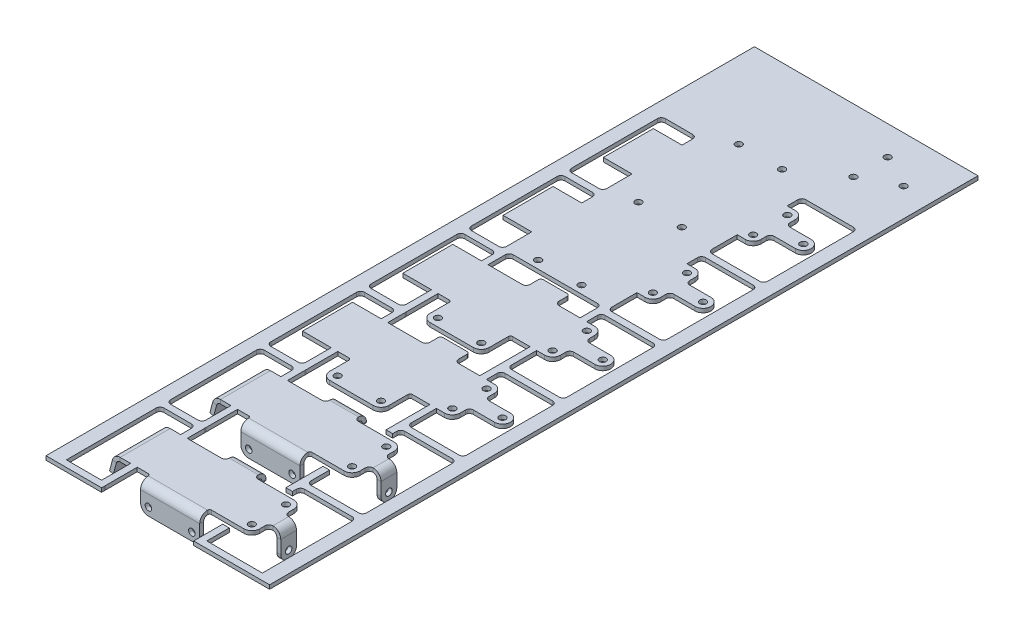
from build123d import *

# Parameters (mm, degrees)
SKETCH1_W                      = 170
SKETCH1_H                      = 3
BASE_FLANGE1_DEPTH             = 538.75
SKETCH7_R                      = 2.5
CUT_EXTRUDE1_DEPTH             = 10
LPATTERN1_COUNT                = 7
LPATTERN1_PITCH                = 76.25
CUT_EXTRUDE2_DEPTH             = 10
CUT_EXTRUDE3_DEPTH             = 10
LPATTERN2_COUNT                = 6
LPATTERN2_PITCH                = 76.25
CUT_EXTRUDE6_DEPTH             = 10
CUT_EXTRUDE7_DEPTH             = 10
LPATTERN3_COUNT                = 5
LPATTERN3_PITCH                = 76.25
SKETCHED_START                 = 52.78356
SKETCHED_BEND3_OUTLINE_W       = 3
SKETCHED_BEND3_OUTLINE_H       = 12
SKETCHED_BEND3_DEPTH           = 18.21644
SKETCHED_START_2               = 50.4
SKETCHED_BEND3_2_OUTLINE_R     = 2.5
SKETCHED_BEND3_2_DEPTH         = 1.8831962
SKETCHED_START_3               = 47.4
SKETCHED_BEND3_3_OUTLINE_R     = 2.5
SKETCHED_BEND3_3_DEPTH         = 6
SKETCHED_START_4               = 410.38
SKETCHED_BEND3_4_DEPTH         = 12
SKETCHED_START_5               = 397.38
SKETCHED_BEND4_DEPTH           = 38
SKETCHED_BEND4_2_DEPTH         = 38
SKETCHED_START_6               = -13.73
SKETCHED_BEND5_DEPTH           = 22
SKETCHED_BEND5_2_DEPTH         = 22
SKETCHED_START_7               = 387
SKETCHED_BEND5_3_DEPTH         = 7.38
SKETCHED_START_8               = 442.26356
SKETCHED_BEND6_OUTLINE_W       = 45
SKETCHED_BEND6_OUTLINE_H       = 3
SKETCHED_BEND6_DEPTH           = 15.23644
SKETCHED_START_9               = 439.88
SKETCHED_BEND6_2_OUTLINE_R     = 2.5
SKETCHED_BEND6_2_DEPTH         = 1.4260588
SKETCHED_START_10              = 436.88
SKETCHED_BEND6_3_OUTLINE_R     = 2.5
SKETCHED_BEND6_3_DEPTH         = 6
SKETCHED_START_11              = -32.73
SKETCHED_BEND6_4_DEPTH         = 45
SKETCHED_BEND7_OUTLINE_W       = 3
SKETCHED_BEND7_OUTLINE_H       = 12
SKETCHED_BEND7_DEPTH           = 18.21644
SKETCHED_BEND7_2_OUTLINE_R     = 2.5
SKETCHED_BEND7_2_DEPTH         = 1.8831962
SKETCHED_BEND7_3_OUTLINE_R     = 2.5
SKETCHED_BEND7_3_DEPTH         = 6
SKETCHED_START_12              = 486.63
SKETCHED_BEND7_4_DEPTH         = 12
SKETCHED_START_13              = 473.63
SKETCHED_BEND8_DEPTH           = 38
SKETCHED_BEND8_2_DEPTH         = 38
SKETCHED_START_14              = 462.5
SKETCHED_BEND9_OUTLINE_W       = 22
SKETCHED_BEND9_OUTLINE_H       = 3
SKETCHED_BEND9_DEPTH           = 2.71356
SKETCHED_START_15              = 467.5482038
SKETCHED_BEND9_2_DEPTH         = 0.0817962
SKETCHED_START_16              = 464.63
SKETCHED_BEND9_3_DEPTH         = 6
SKETCHED_BEND9_4_DEPTH         = 22
SKETCHED_START_17              = 518.49628
SKETCHED_BEND10_OUTLINE_W      = 45
SKETCHED_BEND10_OUTLINE_H      = 3
SKETCHED_BEND10_DEPTH          = 15.25372
SKETCHED_START_18              = 516.13
SKETCHED_BEND10_2_OUTLINE_R    = 2.5
SKETCHED_BEND10_2_DEPTH        = 2.36628
SKETCHED_START_19              = 513.13
SKETCHED_BEND10_3_OUTLINE_R    = 2.5
SKETCHED_BEND10_3_DEPTH        = 3
SKETCHED_BEND10_4_OUTLINE_R    = 2.5
SKETCHED_BEND10_4_DEPTH        = 0.63372
SKETCHED_BEND10_5_DEPTH        = 45
FILLET1_R                      = 3
FILLET2_R                      = 3
FILLET3_R                      = 3
FILLET4_R                      = 3
FILLET5_R                      = 3
FILLET6_R                      = 3
FILLET8_R                      = 3
FILLET9_R                      = 3
FILLET10_R                     = 3
FILLET11_R                     = 3
FILLET12_R                     = 3
FILLET13_R                     = 3
CUT_EXTRUDE8_REACH             = 547.858
SKETCH30_W                     = 5
SKETCH30_H                     = 5
CUT_EXTRUDE8_DIRECTION_2_DEPTH = 546.857796377
LPATTERN4_COUNT                = 2
LPATTERN4_PITCH                = 76.25


with BuildPart() as part:
    # Base-Flange1: sheet metal written as solids
    # Sketch1 → Base-Flange1 (new body)
    with BuildSketch(Plane.XY):
        with Locations((0, -1.5)):
            Rectangle(SKETCH1_W, SKETCH1_H)
    extrude(amount=BASE_FLANGE1_DEPTH)

    # Sketch7 → Cut-Extrude1 (cut)
    with BuildSketch(Plane(origin=(0, 0, 0), x_dir=(1, 0, 0), z_dir=(0, 1, 0))):
        with Locations(Location((38.4, -22.13, 0), (0, 0, 180))):
            Circle(SKETCH7_R)
        with Locations(Location((63.53, -35.13, 0), (0, 0, 180))):
            Circle(SKETCH7_R)
        with Locations(Location((38.4, -48.13, 0), (0, 0, 180))):
            Circle(SKETCH7_R)
        with Locations(Location((-26.73, -70.25, 0), (0, 0, 180))):
            Circle(SKETCH7_R)
        with Locations(Location((6.27, -70.25, 0), (0, 0, 180))):
            Circle(SKETCH7_R)
    cut_extrude1 = extrude(amount=-CUT_EXTRUDE1_DEPTH, mode=Mode.SUBTRACT)

    # LPattern1: Cut-Extrude1 ×7
    with Locations(*[(0, 0, i * LPATTERN1_PITCH) for i in range(1, LPATTERN1_COUNT)]):
        add(cut_extrude1, mode=Mode.SUBTRACT)

    # Sketch10 → Cut-Extrude2 (cut)
    with BuildSketch(Plane(origin=(0, 0, 0), x_dir=(1, 0, 0), z_dir=(0, 1, 0))):
        with BuildLine():
            Line((32.27, -92.38), (32.27, -81.25))
            Line((32.27, -81.25), (74.53, -81.25))
            Line((74.53, -81.25), (74.53, -152.5))
            Line((74.53, -152.5), (32.27, -152.5))
            Line((32.27, -152.5), (32.27, -130.38))
            Line((32.27, -130.38), (38.4, -130.38))
            ThreePointArc((38.4, -130.38), (42.642640687, -128.622640687), (44.4, -124.38))
            Line((44.4, -124.38), (44.4, -120.38))
            ThreePointArc((44.4, -120.38), (45.278679656, -118.258679656), (47.4, -117.38))
            Line((47.4, -117.38), (63.53, -117.38))
            ThreePointArc((63.53, -117.38), (69.53, -111.38), (63.53, -105.38))
            Line((63.53, -105.38), (47.4, -105.38))
            ThreePointArc((47.4, -105.38), (45.278679656, -104.501320344), (44.4, -102.38))
            Line((44.4, -102.38), (44.4, -98.38))
            ThreePointArc((44.4, -98.38), (42.642640687, -94.137359313), (38.4, -92.38))
            Line((38.4, -92.38), (32.27, -92.38))
        make_face()
    cut_extrude2 = extrude(amount=-CUT_EXTRUDE2_DEPTH, mode=Mode.SUBTRACT)

    # Sketch11 → Cut-Extrude3 (cut)
    with BuildSketch(Plane(origin=(0, 0, 0), x_dir=(1, 0, 0), z_dir=(0, 1, 0))):
        Polygon((-47.73, -130.38), (-47.73, -152.5), (-74.53, -152.5), (-74.53, -81.25), (-47.73, -81.25), (-47.73, -92.38), (-69.53, -92.38), (-69.53, -130.38), align=None)
    cut_extrude3 = extrude(amount=-CUT_EXTRUDE3_DEPTH, mode=Mode.SUBTRACT)

    # LPattern2: Cut-Extrude2, Cut-Extrude3 ×6
    with Locations(*[(0, 0, i * LPATTERN2_PITCH) for i in range(1, LPATTERN2_COUNT)]):
        add(cut_extrude2, mode=Mode.SUBTRACT)
        add(cut_extrude3, mode=Mode.SUBTRACT)

    # Sketch14 → Cut-Extrude6 (cut)
    with BuildSketch(Plane(origin=(0, 0, 0), x_dir=(1, 0, 0), z_dir=(0, 1, 0))):
        with BuildLine():
            Line((-42.73, -244.88), (-42.73, -231.75))
            ThreePointArc((-42.73, -231.75), (-41.851320344, -229.628679656), (-39.73, -228.75))
            Line((-39.73, -228.75), (24.27, -228.75))
            ThreePointArc((24.27, -228.75), (26.391320344, -229.628679656), (27.27, -231.75))
            Line((27.27, -231.75), (27.27, -244.88))
            Line((27.27, -244.88), (11.27, -244.88))
            ThreePointArc((11.27, -244.88), (9.148679656, -244.001320344), (8.27, -241.88))
            Line((8.27, -241.88), (8.27, -235.75))
            ThreePointArc((8.27, -235.75), (7.684213562, -234.335786438), (6.27, -233.75))
            Line((6.27, -233.75), (-11.73, -233.75))
            ThreePointArc((-11.73, -233.75), (-13.144213562, -234.335786438), (-13.73, -235.75))
            Line((-13.73, -235.75), (-13.73, -241.88))
            ThreePointArc((-13.73, -241.88), (-14.608679656, -244.001320344), (-16.73, -244.88))
            Line((-16.73, -244.88), (-42.73, -244.88))
        make_face()
    cut_extrude6 = extrude(amount=-CUT_EXTRUDE6_DEPTH, mode=Mode.SUBTRACT)

    # Sketch15 → Cut-Extrude7 (cut)
    with BuildSketch(Plane(origin=(0, 0, 0), x_dir=(1, 0, 0), z_dir=(0, 1, 0))):
        with BuildLine():
            Line((-42.73, -307), (-42.73, -282.88))
            Line((-42.73, -282.88), (-34.23, -282.88))
            ThreePointArc((-34.23, -282.88), (-33.169339828, -283.319339828), (-32.73, -284.38))
            Line((-32.73, -284.38), (-32.73, -299))
            ThreePointArc((-32.73, -299), (-30.972640687, -303.242640687), (-26.73, -305))
            Line((-26.73, -305), (6.27, -305))
            ThreePointArc((6.27, -305), (10.512640687, -303.242640687), (12.27, -299))
            Line((12.27, -299), (12.27, -284.38))
            ThreePointArc((12.27, -284.38), (12.709339828, -283.319339828), (13.77, -282.88))
            Line((13.77, -282.88), (27.27, -282.88))
            Line((27.27, -282.88), (27.27, -307))
            ThreePointArc((27.27, -307), (26.391320344, -309.121320344), (24.27, -310))
            Line((24.27, -310), (-39.73, -310))
            ThreePointArc((-39.73, -310), (-41.851320344, -309.121320344), (-42.73, -307))
        make_face()
    cut_extrude7 = extrude(amount=-CUT_EXTRUDE7_DEPTH, mode=Mode.SUBTRACT)

    # LPattern3: Cut-Extrude6, Cut-Extrude7 ×5
    with Locations(*[(0, 0, i * LPATTERN3_PITCH) for i in range(1, LPATTERN3_COUNT)]):
        add(cut_extrude6, mode=Mode.SUBTRACT)
        add(cut_extrude7, mode=Mode.SUBTRACT)

    # Sketched Bend3: read off the stored shape, not the designer's step
    # Sketched Bend3 outline → Sketched Bend3 (cut)
    with BuildSketch(Plane.YZ.offset(SKETCHED_START)):
        with Locations((-1.5, 416.38)):
            Rectangle(SKETCHED_BEND3_OUTLINE_W, SKETCHED_BEND3_OUTLINE_H)
    extrude(amount=SKETCHED_BEND3_DEPTH, mode=Mode.SUBTRACT)

    # Sketched Bend3 2 outline → Sketched Bend3 2 (add)
    with BuildSketch(Plane.YZ.offset(SKETCHED_START_2)):
        with BuildLine():
            Line((-3, 422.38), (-16.003894325, 422.38))
            ThreePointArc((-16.003894325, 422.38), (-22.003894325, 416.38), (-16.003894325, 410.38))
            Line((-16.003894325, 410.38), (-3, 410.38))
            Line((-3, 410.38), (-3, 422.38))
        make_face()
        with Locations((-16.003894325, 416.38)):
            Circle(SKETCHED_BEND3_2_OUTLINE_R, mode=Mode.SUBTRACT)
    extrude(amount=SKETCHED_BEND3_2_DEPTH)

    # Sketched Bend3 3 outline → Sketched Bend3 3 (add)
    with BuildSketch(Plane.YZ.offset(SKETCHED_START_3)):
        with BuildLine():
            Line((-3, 422.38), (-16.003894325, 422.38))
            ThreePointArc((-16.003894325, 422.38), (-22.003894325, 416.38), (-16.003894325, 410.38))
            Line((-16.003894325, 410.38), (-3, 410.38))
            Line((-3, 410.38), (-3, 422.38))
        make_face()
        with Locations((-16.003894325, 416.38)):
            Circle(SKETCHED_BEND3_3_OUTLINE_R, mode=Mode.SUBTRACT)
    extrude(amount=SKETCHED_BEND3_3_DEPTH)

    # Sketched Bend3 4 outline → Sketched Bend3 4 (cut)
    with BuildSketch(Plane.XY.offset(SKETCHED_START_4)):
        with BuildLine():
            Line((50.4, -24), (50.4, -6))
            ThreePointArc((50.4, -6), (49.521320344, -3.878679656), (47.4, -3))
            Line((47.4, -3), (47.4, -24))
            Line((47.4, -24), (50.4, -24))
        make_face()
        with BuildLine():
            Line((46, 2), (46, 0))
            Line((46, 0), (47.4, 0))
            ThreePointArc((47.4, 0), (51.642640687, -1.757359313), (53.4, -6))
            Line((53.4, -6), (53.4, -3))
            Line((53.4, -3), (52.78356, -3))
            Line((52.78356, -3), (52.78356, 2))
            Line((52.78356, 2), (46, 2))
        make_face()
    extrude(amount=SKETCHED_BEND3_4_DEPTH, mode=Mode.SUBTRACT)

    # Sketched Bend4: read off the stored shape, not the designer's step
    # Sketched Bend4 outline → Sketched Bend4 (cut)
    with BuildSketch(Plane.XY.offset(SKETCHED_START_5)):
        with BuildLine():
            ThreePointArc((-60.926152423, -3), (-58.73, -0.803847577), (-55.73, 0))
            Line((-55.73, 0), (-69.53, 0))
            Line((-69.53, 0), (-69.53, -3))
            Line((-69.53, -3), (-60.926152423, -3))
        make_face()
    extrude(amount=SKETCHED_BEND4_DEPTH, mode=Mode.SUBTRACT)

    # Sketched Bend4 2 outline → Sketched Bend4 2 (add)
    with BuildSketch(Plane.XY.offset(SKETCHED_START_5)):
        with BuildLine():
            Line((-55.73, -3), (-60.926152423, -3))
            ThreePointArc((-60.926152423, -3), (-61.273277195, -3.703899406), (-61.525554958, -4.447085729))
            Line((-61.525554958, -4.447085729), (-63.775963763, -12.845725728))
            Line((-63.775963763, -12.845725728), (-60.878186284, -13.622182863))
            Line((-60.878186284, -13.622182863), (-58.627777479, -5.223542865))
            ThreePointArc((-58.627777479, -5.223542865), (-57.556284287, -3.619939979), (-55.73, -3))
        make_face()
    extrude(amount=SKETCHED_BEND4_2_DEPTH)

    # Sketched Bend5: read off the stored shape, not the designer's step
    # Sketched Bend5 outline → Sketched Bend5 (cut)
    with BuildSketch(Plane.YZ.offset(SKETCHED_START_6)):
        with BuildLine():
            Line((0, 386.25), (0, 394.38))
            ThreePointArc((0, 394.38), (-0.803847577, 391.38), (-3, 389.183847577))
            Line((-3, 389.183847577), (-3, 386.25))
            Line((-3, 386.25), (0, 386.25))
        make_face()
    extrude(amount=SKETCHED_BEND5_DEPTH, mode=Mode.SUBTRACT)

    # Sketched Bend5 2 outline → Sketched Bend5 2 (add)
    with BuildSketch(Plane.YZ.offset(SKETCHED_START_6)):
        with BuildLine():
            ThreePointArc((-6, 388.38), (-4.447085729, 388.584445042), (-3, 389.183847577))
            Line((-3, 389.183847577), (-3, 394.38))
            ThreePointArc((-3, 394.38), (-3.878679656, 392.258679656), (-6, 391.38))
            Line((-6, 391.38), (-8.003894325, 391.38))
            Line((-8.003894325, 391.38), (-8.003894325, 388.38))
            Line((-8.003894325, 388.38), (-6, 388.38))
        make_face()
    extrude(amount=SKETCHED_BEND5_2_DEPTH)

    # Sketched Bend5 3 outline → Sketched Bend5 3 (cut)
    with BuildSketch(Plane.XY.offset(SKETCHED_START_7)):
        with BuildLine():
            Line((-13.73, -8.003894325), (-11.73, -8.003894325))
            ThreePointArc((-11.73, -8.003894325), (-13.144213562, -7.418107887), (-13.73, -6.003894325))
            Line((-13.73, -6.003894325), (-13.73, -8.003894325))
        make_face()
        with BuildLine():
            ThreePointArc((8.27, -6.003894325), (7.684213563, -7.418107887), (6.27, -8.003894325))
            Line((6.27, -8.003894325), (8.27, -8.003894325))
            Line((8.27, -8.003894325), (8.27, -6.003894325))
        make_face()
    extrude(amount=SKETCHED_BEND5_3_DEPTH, mode=Mode.SUBTRACT)

    # Sketched Bend6: read off the stored shape, not the designer's step
    # Sketched Bend6 outline → Sketched Bend6 (cut)
    with BuildSketch(Plane.XY.offset(SKETCHED_START_8)):
        with Locations((-10.23, -1.5)):
            Rectangle(SKETCHED_BEND6_OUTLINE_W, SKETCHED_BEND6_OUTLINE_H)
    extrude(amount=SKETCHED_BEND6_DEPTH, mode=Mode.SUBTRACT)

    # Sketched Bend6 2 outline → Sketched Bend6 2 (add)
    with BuildSketch(Plane.XY.offset(SKETCHED_START_9)):
        with BuildLine():
            Line((12.27, -14.493894325), (12.27, -3))
            Line((12.27, -3), (-32.73, -3))
            Line((-32.73, -3), (-32.73, -14.493894325))
            ThreePointArc((-32.73, -14.493894325), (-30.972640688, -18.736535012), (-26.73, -20.493894325))
            Line((-26.73, -20.493894325), (6.27, -20.493894325))
            ThreePointArc((6.27, -20.493894325), (10.512640687, -18.736535012), (12.27, -14.493894325))
        make_face()
        with Locations((-26.73, -14.493894325)):
            Circle(SKETCHED_BEND6_2_OUTLINE_R, mode=Mode.SUBTRACT)
        with Locations((6.27, -14.493894325)):
            Circle(SKETCHED_BEND6_2_OUTLINE_R, mode=Mode.SUBTRACT)
    extrude(amount=SKETCHED_BEND6_2_DEPTH)

    # Sketched Bend6 3 outline → Sketched Bend6 3 (add)
    with BuildSketch(Plane.XY.offset(SKETCHED_START_10)):
        with BuildLine():
            Line((12.27, -14.493894325), (12.27, -3))
            Line((12.27, -3), (-32.73, -3))
            Line((-32.73, -3), (-32.73, -14.493894325))
            ThreePointArc((-32.73, -14.493894325), (-30.972640688, -18.736535012), (-26.73, -20.493894325))
            Line((-26.73, -20.493894325), (6.27, -20.493894325))
            ThreePointArc((6.27, -20.493894325), (10.512640687, -18.736535012), (12.27, -14.493894325))
        make_face()
        with Locations((-26.73, -14.493894325)):
            Circle(SKETCHED_BEND6_3_OUTLINE_R, mode=Mode.SUBTRACT)
        with Locations((6.27, -14.493894325)):
            Circle(SKETCHED_BEND6_3_OUTLINE_R, mode=Mode.SUBTRACT)
    extrude(amount=SKETCHED_BEND6_3_DEPTH)

    # Sketched Bend6 4 outline → Sketched Bend6 4 (cut)
    with BuildSketch(Plane.YZ.offset(SKETCHED_START_11)):
        with BuildLine():
            Line((-6, 439.88), (-20.493894325, 439.88))
            Line((-20.493894325, 439.88), (-20.493894325, 436.88))
            Line((-20.493894325, 436.88), (-3, 436.88))
            ThreePointArc((-3, 436.88), (-3.878679656, 439.001320344), (-6, 439.88))
        make_face()
        with BuildLine():
            ThreePointArc((-6, 442.88), (-1.757359313, 441.122640687), (0, 436.88))
            Line((0, 436.88), (0, 442.26356))
            Line((0, 442.26356), (-3, 442.26356))
            Line((-3, 442.26356), (-3, 442.88))
            Line((-3, 442.88), (-6, 442.88))
        make_face()
    extrude(amount=SKETCHED_BEND6_4_DEPTH, mode=Mode.SUBTRACT)

    # Sketched Bend7: read off the stored shape, not the designer's step
    # Sketched Bend7 outline → Sketched Bend7 (cut)
    with BuildSketch(Plane.YZ.offset(SKETCHED_START)):
        with Locations((-1.5, 492.63)):
            Rectangle(SKETCHED_BEND7_OUTLINE_W, SKETCHED_BEND7_OUTLINE_H)
    extrude(amount=SKETCHED_BEND7_DEPTH, mode=Mode.SUBTRACT)

    # Sketched Bend7 2 outline → Sketched Bend7 2 (add)
    with BuildSketch(Plane.YZ.offset(SKETCHED_START_2)):
        with BuildLine():
            Line((-16.003894325, 486.63), (-3, 486.63))
            Line((-3, 486.63), (-3, 498.63))
            Line((-3, 498.63), (-16.003894325, 498.63))
            ThreePointArc((-16.003894325, 498.63), (-22.003894325, 492.63), (-16.003894325, 486.63))
        make_face()
        with Locations((-16.003894325, 492.63)):
            Circle(SKETCHED_BEND7_2_OUTLINE_R, mode=Mode.SUBTRACT)
    extrude(amount=SKETCHED_BEND7_2_DEPTH)

    # Sketched Bend7 3 outline → Sketched Bend7 3 (add)
    with BuildSketch(Plane.YZ.offset(SKETCHED_START_3)):
        with BuildLine():
            Line((-16.003894325, 486.63), (-3, 486.63))
            Line((-3, 486.63), (-3, 498.63))
            Line((-3, 498.63), (-16.003894325, 498.63))
            ThreePointArc((-16.003894325, 498.63), (-22.003894325, 492.63), (-16.003894325, 486.63))
        make_face()
        with Locations((-16.003894325, 492.63)):
            Circle(SKETCHED_BEND7_3_OUTLINE_R, mode=Mode.SUBTRACT)
    extrude(amount=SKETCHED_BEND7_3_DEPTH)

    # Sketched Bend7 4 outline → Sketched Bend7 4 (cut)
    with BuildSketch(Plane.XY.offset(SKETCHED_START_12)):
        with BuildLine():
            Line((50.4, -24), (50.4, -6))
            ThreePointArc((50.4, -6), (49.521320344, -3.878679656), (47.4, -3))
            Line((47.4, -3), (47.4, -24))
            Line((47.4, -24), (50.4, -24))
        make_face()
        with BuildLine():
            Line((46, 2), (46, 0))
            Line((46, 0), (47.4, 0))
            ThreePointArc((47.4, 0), (51.642640687, -1.757359313), (53.4, -6))
            Line((53.4, -6), (53.4, -3))
            Line((53.4, -3), (52.78356, -3))
            Line((52.78356, -3), (52.78356, 2))
            Line((52.78356, 2), (46, 2))
        make_face()
    extrude(amount=SKETCHED_BEND7_4_DEPTH, mode=Mode.SUBTRACT)

    # Sketched Bend8: read off the stored shape, not the designer's step
    # Sketched Bend8 outline → Sketched Bend8 (cut)
    with BuildSketch(Plane.XY.offset(SKETCHED_START_13)):
        with BuildLine():
            ThreePointArc((-60.926152423, -3), (-58.73, -0.803847577), (-55.73, 0))
            Line((-55.73, 0), (-69.53, 0))
            Line((-69.53, 0), (-69.53, -3))
            Line((-69.53, -3), (-60.926152423, -3))
        make_face()
    extrude(amount=SKETCHED_BEND8_DEPTH, mode=Mode.SUBTRACT)

    # Sketched Bend8 2 outline → Sketched Bend8 2 (add)
    with BuildSketch(Plane.XY.offset(SKETCHED_START_13)):
        with BuildLine():
            Line((-55.73, -3), (-60.926152423, -3))
            ThreePointArc((-60.926152423, -3), (-61.273277195, -3.703899406), (-61.525554958, -4.447085729))
            Line((-61.525554958, -4.447085729), (-63.775963763, -12.845725728))
            Line((-63.775963763, -12.845725728), (-60.878186284, -13.622182863))
            Line((-60.878186284, -13.622182863), (-58.627777479, -5.223542865))
            ThreePointArc((-58.627777479, -5.223542865), (-57.556284287, -3.619939979), (-55.73, -3))
        make_face()
    extrude(amount=SKETCHED_BEND8_2_DEPTH)

    # Sketched Bend9: read off the stored shape, not the designer's step
    # Sketched Bend9 outline → Sketched Bend9 (cut)
    with BuildSketch(Plane.XY.offset(SKETCHED_START_14)):
        with Locations((-2.73, -1.5)):
            Rectangle(SKETCHED_BEND9_OUTLINE_W, SKETCHED_BEND9_OUTLINE_H)
    extrude(amount=SKETCHED_BEND9_DEPTH, mode=Mode.SUBTRACT)

    # Sketched Bend9 2 outline → Sketched Bend9 2 (add)
    with BuildSketch(Plane.XY.offset(SKETCHED_START_15)):
        with BuildLine():
            Line((8.27, -3), (-13.73, -3))
            Line((-13.73, -3), (-13.73, -6.003894325))
            ThreePointArc((-13.73, -6.003894325), (-13.144213562, -7.418107887), (-11.73, -8.003894325))
            Line((-11.73, -8.003894325), (6.27, -8.003894325))
            ThreePointArc((6.27, -8.003894325), (7.684213563, -7.418107887), (8.27, -6.003894325))
            Line((8.27, -6.003894325), (8.27, -3))
        make_face()
    extrude(amount=SKETCHED_BEND9_2_DEPTH)

    # Sketched Bend9 3 outline → Sketched Bend9 3 (add)
    with BuildSketch(Plane.XY.offset(SKETCHED_START_16)):
        with BuildLine():
            Line((8.27, -3), (-13.73, -3))
            Line((-13.73, -3), (-13.73, -6.003894325))
            ThreePointArc((-13.73, -6.003894325), (-13.144213562, -7.418107887), (-11.73, -8.003894325))
            Line((-11.73, -8.003894325), (6.27, -8.003894325))
            ThreePointArc((6.27, -8.003894325), (7.684213563, -7.418107887), (8.27, -6.003894325))
            Line((8.27, -6.003894325), (8.27, -3))
        make_face()
    extrude(amount=SKETCHED_BEND9_3_DEPTH)

    # Sketched Bend9 4 outline → Sketched Bend9 4 (cut)
    with BuildSketch(Plane.YZ.offset(SKETCHED_START_6)):
        with BuildLine():
            Line((0, 465.21356), (0, 470.63))
            ThreePointArc((0, 470.63), (-1.757359313, 466.387359313), (-6, 464.63))
            Line((-6, 464.63), (-3, 464.63))
            Line((-3, 464.63), (-3, 465.21356))
            Line((-3, 465.21356), (0, 465.21356))
        make_face()
        with BuildLine():
            Line((-8.003894325, 470.63), (-8.003894325, 467.63))
            Line((-8.003894325, 467.63), (-6, 467.63))
            ThreePointArc((-6, 467.63), (-3.878679656, 468.508679656), (-3, 470.63))
            Line((-3, 470.63), (-8.003894325, 470.63))
        make_face()
    extrude(amount=SKETCHED_BEND9_4_DEPTH, mode=Mode.SUBTRACT)

    # Sketched Bend10: read off the stored shape, not the designer's step
    # Sketched Bend10 outline → Sketched Bend10 (cut)
    with BuildSketch(Plane.XY.offset(SKETCHED_START_17)):
        with Locations((-10.23, -1.5)):
            Rectangle(SKETCHED_BEND10_OUTLINE_W, SKETCHED_BEND10_OUTLINE_H)
    extrude(amount=SKETCHED_BEND10_DEPTH, mode=Mode.SUBTRACT)

    # Sketched Bend10 2 outline → Sketched Bend10 2 (add)
    with BuildSketch(Plane.XY.offset(SKETCHED_START_18)):
        with BuildLine():
            Line((12.27, -14.493894325), (12.27, -3))
            Line((12.27, -3), (-32.73, -3))
            Line((-32.73, -3), (-32.73, -14.493894325))
            ThreePointArc((-32.73, -14.493894325), (-30.972640687, -18.736535013), (-26.73, -20.493894326))
            Line((-26.73, -20.493894326), (6.27, -20.493894326))
            ThreePointArc((6.27, -20.493894326), (10.512640687, -18.736535013), (12.27, -14.493894325))
        make_face()
        with Locations((-26.73, -14.493894325)):
            Circle(SKETCHED_BEND10_2_OUTLINE_R, mode=Mode.SUBTRACT)
        with Locations((6.27, -14.493894325)):
            Circle(SKETCHED_BEND10_2_OUTLINE_R, mode=Mode.SUBTRACT)
    extrude(amount=SKETCHED_BEND10_2_DEPTH)

    # Sketched Bend10 3 outline → Sketched Bend10 3 (add)
    with BuildSketch(Plane.XY.offset(SKETCHED_START_19)):
        with BuildLine():
            Line((12.27, -14.493894325), (12.27, -3))
            Line((12.27, -3), (-32.73, -3))
            Line((-32.73, -3), (-32.73, -14.493894325))
            ThreePointArc((-32.73, -14.493894325), (-30.972640687, -18.736535013), (-26.73, -20.493894326))
            Line((-26.73, -20.493894326), (6.27, -20.493894326))
            ThreePointArc((6.27, -20.493894326), (10.512640687, -18.736535013), (12.27, -14.493894325))
        make_face()
        with Locations((-26.73, -14.493894325)):
            Circle(SKETCHED_BEND10_3_OUTLINE_R, mode=Mode.SUBTRACT)
        with Locations((6.27, -14.493894325)):
            Circle(SKETCHED_BEND10_3_OUTLINE_R, mode=Mode.SUBTRACT)
    extrude(amount=SKETCHED_BEND10_3_DEPTH)

    # Sketched Bend10 4 outline → Sketched Bend10 4 (add)
    with BuildSketch(Plane.XY.offset(SKETCHED_START_17)):
        with BuildLine():
            Line((12.27, -14.493894325), (12.27, -3))
            Line((12.27, -3), (-32.73, -3))
            Line((-32.73, -3), (-32.73, -14.493894325))
            ThreePointArc((-32.73, -14.493894325), (-30.972640687, -18.736535013), (-26.73, -20.493894326))
            Line((-26.73, -20.493894326), (6.27, -20.493894326))
            ThreePointArc((6.27, -20.493894326), (10.512640687, -18.736535013), (12.27, -14.493894325))
        make_face()
        with Locations((-26.73, -14.493894325)):
            Circle(SKETCHED_BEND10_4_OUTLINE_R, mode=Mode.SUBTRACT)
        with Locations((6.27, -14.493894325)):
            Circle(SKETCHED_BEND10_4_OUTLINE_R, mode=Mode.SUBTRACT)
    extrude(amount=SKETCHED_BEND10_4_DEPTH)

    # Sketched Bend10 5 outline → Sketched Bend10 5 (cut)
    with BuildSketch(Plane.YZ.offset(SKETCHED_START_11)):
        with BuildLine():
            Line((-6, 516.13), (-20.493894326, 516.13))
            Line((-20.493894326, 516.13), (-20.493894326, 513.13))
            Line((-20.493894326, 513.13), (-3, 513.13))
            ThreePointArc((-3, 513.13), (-3.878679656, 515.251320344), (-6, 516.13))
        make_face()
        with BuildLine():
            ThreePointArc((-6, 519.13), (-1.757359313, 517.372640687), (0, 513.13))
            Line((0, 513.13), (0, 518.49628))
            Line((0, 518.49628), (-3, 518.49628))
            Line((-3, 518.49628), (-3, 519.13))
            Line((-3, 519.13), (-6, 519.13))
        make_face()
    extrude(amount=SKETCHED_BEND10_5_DEPTH, mode=Mode.SUBTRACT)

    # Fillet1
    fillet1_edges = [part.edges().sort_by_distance(p)[0] for p in [
        (32.27, -1.5, 152.5),
        (74.53, -1.5, 152.5),
        (74.53, -1.5, 81.25),
        (32.27, -1.5, 81.25),
    ]]
    fillet(fillet1_edges, radius=FILLET1_R)

    # Fillet2
    fillet2_edges = [part.edges().sort_by_distance(p)[0] for p in [
        (-47.73, -1.5, 81.25),
        (-74.53, -1.5, 81.25),
        (-74.53, -1.5, 152.5),
        (-47.73, -1.5, 152.5),
    ]]
    fillet(fillet2_edges, radius=FILLET2_R)

    # Fillet3
    fillet3_edges = [part.edges().sort_by_distance(p)[0] for p in [
        (32.27, -1.5, 228.75),
        (74.53, -1.5, 228.75),
        (74.53, -1.5, 157.5),
        (32.27, -1.5, 157.5),
    ]]
    fillet(fillet3_edges, radius=FILLET3_R)

    # Fillet4
    fillet4_edges = [part.edges().sort_by_distance(p)[0] for p in [
        (-47.73, -1.5, 157.5),
        (-74.53, -1.5, 157.5),
        (-74.53, -1.5, 228.75),
        (-47.73, -1.5, 228.75),
    ]]
    fillet(fillet4_edges, radius=FILLET4_R)

    # Fillet5
    fillet5_edges = [part.edges().sort_by_distance(p)[0] for p in [
        (32.27, -1.5, 305),
        (74.53, -1.5, 305),
        (74.53, -1.5, 233.75),
        (32.27, -1.5, 233.75),
    ]]
    fillet(fillet5_edges, radius=FILLET5_R)

    # Fillet6
    fillet6_edges = [part.edges().sort_by_distance(p)[0] for p in [
        (-47.73, -1.5, 233.75),
        (-74.53, -1.5, 233.75),
        (-74.53, -1.5, 305),
        (-47.73, -1.5, 305),
    ]]
    fillet(fillet6_edges, radius=FILLET6_R)

    # Fillet8
    fillet8_edges = [part.edges().sort_by_distance(p)[0] for p in [
        (-47.73, -1.5, 310),
        (-74.53, -1.5, 310),
        (-74.53, -1.5, 381.25),
        (-47.73, -1.5, 381.25),
    ]]
    fillet(fillet8_edges, radius=FILLET8_R)

    # Fillet9
    fillet9_edges = [part.edges().sort_by_distance(p)[0] for p in [
        (32.27, -1.5, 381.25),
        (74.53, -1.5, 381.25),
        (74.53, -1.5, 310),
        (32.27, -1.5, 310),
    ]]
    fillet(fillet9_edges, radius=FILLET9_R)

    # Fillet10
    fillet10_edges = [part.edges().sort_by_distance(p)[0] for p in [
        (-47.73, -1.5, 386.25),
        (-74.53, -1.5, 386.25),
        (-74.53, -1.5, 457.5),
        (-47.73, -1.5, 457.5),
    ]]
    fillet(fillet10_edges, radius=FILLET10_R)

    # Fillet11
    fillet11_edges = [part.edges().sort_by_distance(p)[0] for p in [
        (32.27, -1.5, 457.5),
        (74.53, -1.5, 457.5),
        (74.53, -1.5, 386.25),
        (32.27, -1.5, 386.25),
    ]]
    fillet(fillet11_edges, radius=FILLET11_R)

    # Fillet12
    fillet12_edges = [part.edges().sort_by_distance(p)[0] for p in [
        (-47.73, -1.5, 462.5),
        (-74.53, -1.5, 462.5),
    ]]
    fillet(fillet12_edges, radius=FILLET12_R)

    # Fillet13
    fillet13_edges = [part.edges().sort_by_distance(p)[0] for p in [
        (74.53, -1.5, 462.5),
        (32.27, -1.5, 462.5),
    ]]
    fillet(fillet13_edges, radius=FILLET13_R)

    # Sketch30 → Cut-Extrude8 (cut, up to next)
    with BuildSketch(Plane(origin=(0, 0, 0), x_dir=(1, 0, 0), z_dir=(0, 1, 0)), mode=Mode.PRIVATE) as cut_extrude8_sk1:
        with Locations((29.77, -394.88)):
            Rectangle(SKETCH30_W, SKETCH30_H)
    cut_extrude8_tool1 = extrude(cut_extrude8_sk1.sketch, amount=-CUT_EXTRUDE8_REACH, mode=Mode.PRIVATE) & part.part
    # Sketch30 → Cut-Extrude8 (cut, up to next)
    with BuildSketch(Plane(origin=(0, 0, 0), x_dir=(1, 0, 0), z_dir=(0, 1, 0)), mode=Mode.PRIVATE) as cut_extrude8_sk2:
        with Locations((29.77, -437.88)):
            Rectangle(SKETCH30_W, SKETCH30_H)
    cut_extrude8_tool2 = extrude(cut_extrude8_sk2.sketch, amount=-CUT_EXTRUDE8_REACH, mode=Mode.PRIVATE) & part.part
    cut_extrude8_1 = cut_extrude8_tool1.solids().sort_by_distance((29.77, 0, 394.88))[0]
    add(cut_extrude8_1, mode=Mode.SUBTRACT)
    cut_extrude8_2 = cut_extrude8_tool2.solids().sort_by_distance((29.77, 0, 437.88))[0]
    add(cut_extrude8_2, mode=Mode.SUBTRACT)
    cut_extrude8 = cut_extrude8_1 + cut_extrude8_2  # Cut-Extrude8 as one shape, for the pattern or mirror that repeats it

    # Sketch30 → Cut-Extrude8 direction 2 (cut)
    with BuildSketch(Plane(origin=(0, 0, 0), x_dir=(1, 0, 0), z_dir=(0, 1, 0))):
        with Locations((29.77, -394.88)):
            Rectangle(SKETCH30_W, SKETCH30_H)
        with Locations((29.77, -437.88)):
            Rectangle(SKETCH30_W, SKETCH30_H)
    cut_extrude8_direction_2 = extrude(amount=CUT_EXTRUDE8_DIRECTION_2_DEPTH, mode=Mode.SUBTRACT)

    # LPattern4: Cut-Extrude8, Cut-Extrude8 direction 2 ×2
    with Locations(*[(0, 0, i * LPATTERN4_PITCH) for i in range(1, LPATTERN4_COUNT)]):
        add(cut_extrude8, mode=Mode.SUBTRACT)
        add(cut_extrude8_direction_2, mode=Mode.SUBTRACT)


solid = part.part
